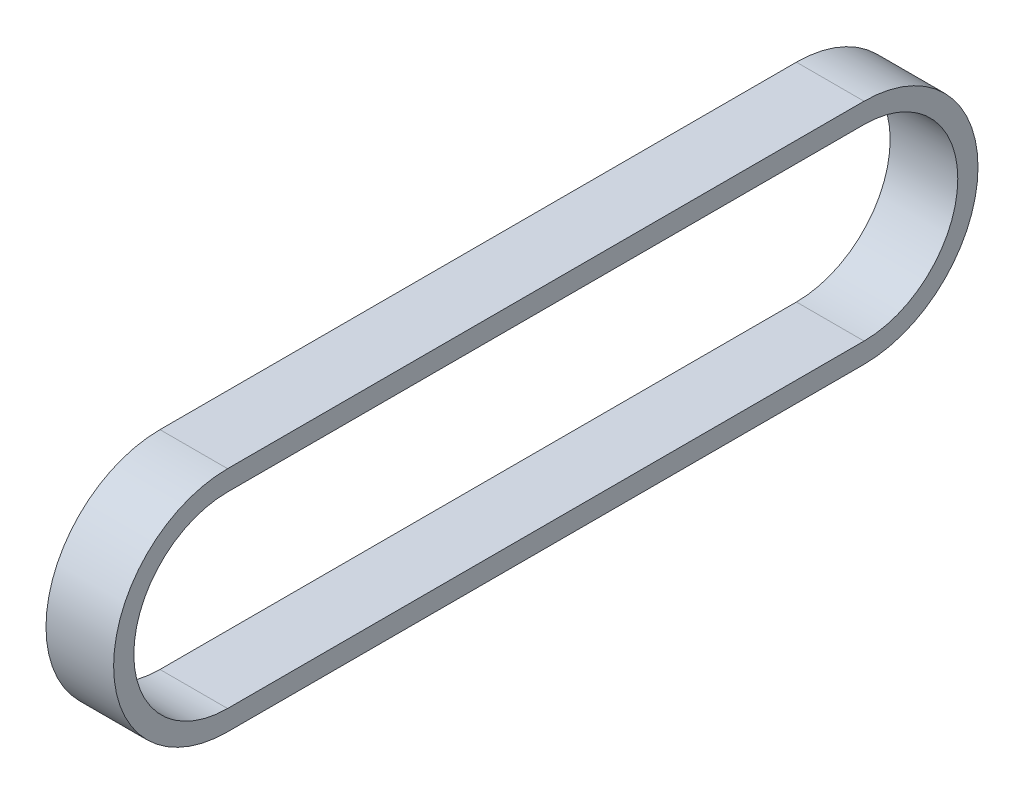
from build123d import *

# Parameters (mm, degrees)
EXTRUDE_THIN1_DEPTH = 8.5


with BuildPart() as part:
    # Sketch1 → Extrude-Thin1 (new body)
    with BuildSketch(Plane(origin=(0, 0, 0), x_dir=(0, 0, -1), z_dir=(1, 0, 0))):
        with BuildLine():
            Line((40.005, -14.3256), (-40.005, -14.3256))
            ThreePointArc((-40.005, -14.3256), (-54.3306, 0), (-40.005, 14.3256))
            Line((-40.005, 14.3256), (40.005, 14.3256))
            ThreePointArc((40.005, 14.3256), (54.3306, 0), (40.005, -14.3256))
        make_face()
        with BuildLine():
            Line((40.005, -11.7856), (-40.005, -11.7856))
            ThreePointArc((-40.005, -11.7856), (-51.7906, 0), (-40.005, 11.7856))
            Line((-40.005, 11.7856), (40.005, 11.7856))
            ThreePointArc((40.005, 11.7856), (51.7906, 0), (40.005, -11.7856))
        make_face(mode=Mode.SUBTRACT)
    extrude(amount=EXTRUDE_THIN1_DEPTH)


solid = part.part
